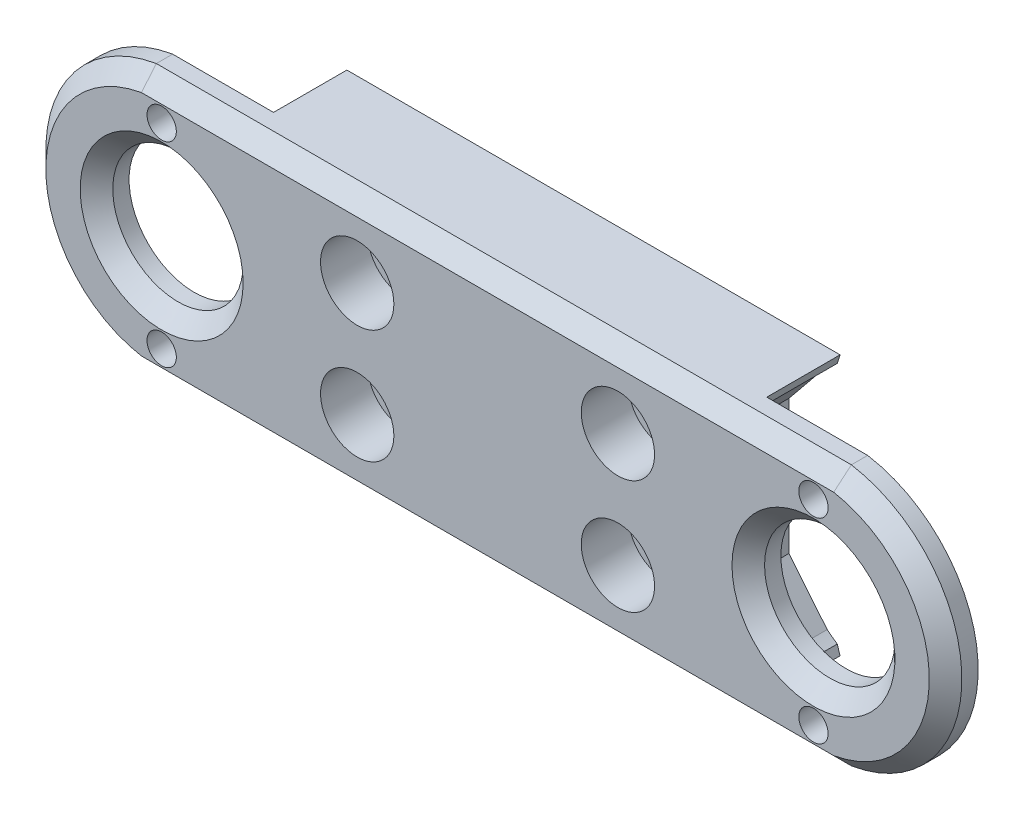
from build123d import *

# Parameters (mm, degrees)
CROQUIS1_R              = 0.9
CROQUIS1_R_2            = 1.1
SALIENTE_EXTRUIR1_DEPTH = 6.5
CORTAR_EXTRUIR6_DEPTH   = 4.5
CHAFL_N1_SIZE           = 1
CHAFL_N1_SIZE_2         = 0.742384029
CROQUIS5_W              = 12
CROQUIS5_H              = 2.5
CORTAR_EXTRUIR7_DEPTH   = 3
CROQUIS6_R              = 2.25
CORTAR_EXTRUIR8_DEPTH   = 2.9
CHAFL_N3_SIZE           = 0.2
CROQUIS7_R              = 4
CORTAR_EXTRUIR9_DEPTH   = 23.5
CHAFL_N2_SIZE           = 1
CORTAR_EXTRUIR2_START   = -6.5
CROQUIS3_W              = 6
CROQUIS3_H              = 17.049295702
CORTAR_EXTRUIR2_DEPTH   = 3
CROQUIS8_W              = 10.359823846
CROQUIS8_H              = 13.918607014
CORTAR_EXTRUIR10_DEPTH  = 5.5


with BuildPart() as part:
    # Croquis1 → Saliente-Extruir1 (new body)
    with BuildSketch(Plane.XY):
        with BuildLine():
            Line((-1.326649916, 8), (20, 8))
            Line((20, 8), (20, 0))
            Line((20, 0), (8, 0))
            Line((8, 0), (-8.109253973, 0))
            ThreePointArc((-8.109253973, 0), (-6.185391706, 5.24413286), (-1.326649916, 8))
        make_face()
        with Locations(Location((0, 6, 0), (0, 0, 180))):
            Circle(CROQUIS1_R, mode=Mode.SUBTRACT)
        with Locations(Location((12, 3.5, 0), (0, 0, 180))):
            Circle(CROQUIS1_R_2, mode=Mode.SUBTRACT)
    extrude(amount=SALIENTE_EXTRUIR1_DEPTH)

    # Croquis4 → Cortar-Extruir6 (cut)
    with BuildSketch(Plane(origin=(0, 0, 0), x_dir=(-1, 0, 0), z_dir=(0, 0, -1))):
        with BuildLine():
            Line((-5.656854249, 7), (-8, 4.123105626))
            Line((-8, 4.123105626), (-8, 0))
            Line((-8, 0), (8.109253973, 0))
            Line((8.109253973, 0), (9, 0))
            ThreePointArc((9, 0), (3.878679656, 8.121320344), (-5.656854249, 7))
        make_face()
    extrude(amount=-CORTAR_EXTRUIR6_DEPTH, mode=Mode.SUBTRACT)

    # Chaflán1
    # the kernel refuses this chamfer: 1, 0.742384029 mm, written as the material it takes off along each edge
    with BuildSketch(Plane(origin=(-5.698510996, 8, 6.5), x_dir=(0, 0, -1), z_dir=(1, 0, 0))) as chafl_n1_piece_1:
        Polygon((CHAFL_N1_SIZE, 0), (0, -CHAFL_N1_SIZE), (0, 0), align=None)
    extrude(amount=28.270193984, mode=Mode.SUBTRACT)
    with BuildSketch(Plane(origin=(4.123105626, 8, 4.5), x_dir=(1, 0, 0), z_dir=(0, 0, -1))) as chafl_n1_piece_2:
        with BuildLine():
            Line((CHAFL_N1_SIZE_2, 0), (0.916025454, 0.542979283))
            ThreePointArc((0.916025454, 0.542979283), (0.478949419, 0.265590562), (0, 0))
            Line((0, 0), (CHAFL_N1_SIZE_2, 0))
        make_face()
    extrude(amount=7.23772815, mode=Mode.SUBTRACT)
    with BuildSketch(Plane(origin=(0, 0, 6.5), x_dir=(-0.9501026430594787, -0.31193744188762096, 0), z_dir=(0.31193744188762096, -0.9501026430594787, 0))) as chafl_n1_piece_3:
        Polygon((8.109253973 - CHAFL_N1_SIZE, 0), (8.109253973, CHAFL_N1_SIZE), (8.109253973, 0), align=None)
    revolve(axis=Axis((0, 0, 6.5), (0, 0, -1)), revolution_arc=116.936314038, mode=Mode.SUBTRACT)

    # Croquis5 → Cortar-Extruir7 (cut)
    with BuildSketch(Plane(origin=(0, 0, 0), x_dir=(-1, 0, 0), z_dir=(0, 0, -1))):
        with Locations((-14, 1.25)):
            Rectangle(CROQUIS5_W, CROQUIS5_H)
    extrude(amount=-CORTAR_EXTRUIR7_DEPTH, mode=Mode.SUBTRACT)

    # Croquis6 → Cortar-Extruir8 (cut)
    with BuildSketch(Plane.XY.offset(6.5)):
        with Locations((12, 3.5)):
            Circle(CROQUIS6_R)
    extrude(amount=-CORTAR_EXTRUIR8_DEPTH, mode=Mode.SUBTRACT)

    # Chaflán3
    chafl_n3_edges = [part.edges().sort_by_distance(p)[0] for p in [
        (0.9, 6, 4.5),
    ]]
    chamfer(chafl_n3_edges, length=CHAFL_N3_SIZE)

    # Simetría1: part across plane


with BuildPart() as part_1:
    add(part.part)
    add(part.part.mirror(Plane(origin=(20, 0, 6.5), x_dir=(0, 0, 1), z_dir=(0, 1, 0))))

    # Croquis7 → Cortar-Extruir9 (cut, through all)
    with BuildSketch(Plane.XY.offset(6.5)):
        Circle(CROQUIS7_R)
    extrude(amount=-CORTAR_EXTRUIR9_DEPTH, mode=Mode.SUBTRACT)

    # Chaflán2
    chafl_n2_edges = [part_1.edges().sort_by_distance(p)[0] for p in [
        (-4, 0, 6.5),
    ]]
    chamfer(chafl_n2_edges, length=CHAFL_N2_SIZE)

    # Simetría2: part across plane


with BuildPart() as part_2:
    add(part_1.part)
    add(part_1.part.mirror(Plane(origin=(20, 8, 6.5), x_dir=(0, 0, 1), z_dir=(-1, 0, 0))))

    # Croquis3 → Cortar-Extruir2 (cut)
    with BuildSketch(Plane.XY.offset(6.5).offset(CORTAR_EXTRUIR2_START)):
        with Locations((20, -8)):
            Rectangle(CROQUIS3_W, CROQUIS3_H)
    extrude(amount=CORTAR_EXTRUIR2_DEPTH, mode=Mode.SUBTRACT)

    # Croquis8 → Cortar-Extruir10 (cut)
    with BuildSketch(Plane(origin=(0, 0, 0), x_dir=(-1, 0, 0), z_dir=(0, 0, -1))):
        with Locations((-20, 0)):
            Rectangle(CROQUIS8_W, CROQUIS8_H)
    extrude(amount=-CORTAR_EXTRUIR10_DEPTH, mode=Mode.SUBTRACT)


solid = part_2.part
